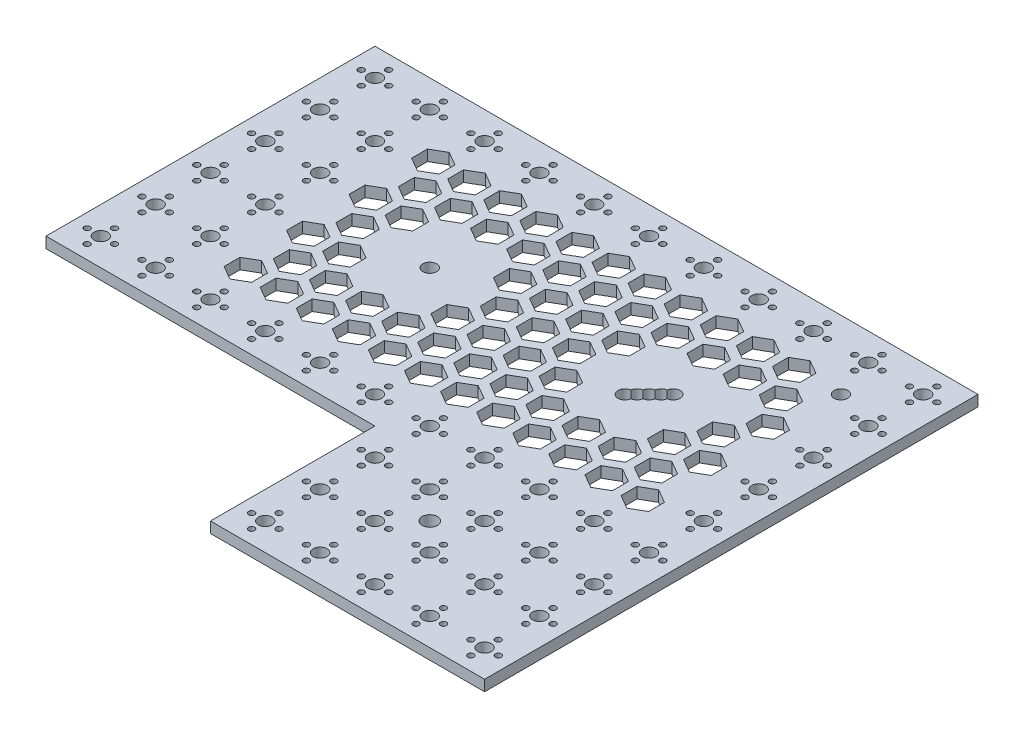
from build123d import *

# Parameters (mm, degrees)
BOSS_EXTRUDE1_DEPTH  = 6.35
SKETCH4_R            = 4
SKETCH4_R_2          = 4.5
CUT_EXTRUDE1_DEPTH   = 341.223929934
SKETCH4_3_R          = 4
CUT_EXTRUDE7_DEPTH   = 10
LPATTERN3_COUNT      = 3
LPATTERN3_PITCH      = 5
LPATTERN3_COL_COUNT  = 3
LPATTERN3_COL_PITCH  = 5
SKETCH7_R            = 4
CUT_EXTRUDE4_DEPTH   = 341.223929934
SKETCH10_R           = 1.75
CUT_EXTRUDE5_DEPTH   = 341.223929934
LPATTERN2_COUNT      = 11
LPATTERN2_PITCH      = 32
LPATTERN2_COUNT_DIR2 = 9
LPATTERN2_PITCH_DIR2 = 32
LPATTERN1_COUNT      = 11
LPATTERN1_PITCH      = 32
LPATTERN1_COUNT_DIR2 = 9
LPATTERN1_PITCH_DIR2 = 32
CUT_EXTRUDE6_DEPTH   = 341.223929934
FILL_PATTERN1_DEPTH  = 6.35
SKETCH15_R           = 4
CUT_EXTRUDE8_DEPTH   = 341.223929934


# Read off the part's stored shape, not the designer's step: Fill Pattern1
with BuildPart() as part:
    # Sketch3 → Boss-Extrude1 (new body)
    with BuildSketch(Plane(origin=(0, 0, 0), x_dir=(1, 0, 0), z_dir=(0, 1, 0))):
        Polygon((-256, 224), (-256, 32), (-64, 32), (-64, -64), (96, -64), (96, 224), align=None)
    extrude(amount=BOSS_EXTRUDE1_DEPTH)

    # Sketch4 → Cut-Extrude1 (cut, through all)
    with BuildSketch(Plane(origin=(0, 6.35, 0), x_dir=(1, 0, 0), z_dir=(0, 1, 0))):
        with Locations(Location((-128, 128, 0), (0, 0, 270))):
            Circle(SKETCH4_R)
        with Locations(Location((0, 0, 0), (0, 0, 270))):
            Circle(SKETCH4_R_2)
    extrude(amount=-CUT_EXTRUDE1_DEPTH, mode=Mode.SUBTRACT)

    # Sketch4<3> → Cut-Extrude7 (cut)
    with BuildSketch(Plane(origin=(0, 6.35, 0), x_dir=(1, 0, 0), z_dir=(0, 1, 0))):
        with Locations(Location((0, 128, 0), (0, 0, 270))):
            Circle(SKETCH4_3_R)
    cut_extrude7 = extrude(amount=-CUT_EXTRUDE7_DEPTH, mode=Mode.SUBTRACT)

    # LPattern3: Cut-Extrude7 ×3
    with Locations(*[Vector(0.7071067811865454, 0, -0.7071067811865497) * (i * LPATTERN3_PITCH) for i in range(1, LPATTERN3_COUNT)]):
        add(cut_extrude7, mode=Mode.SUBTRACT)

    # LPattern3 col: Cut-Extrude7 ×3
    with Locations(*[Vector(-0.7071067811865468, 0, 0.7071067811865483) * (i * LPATTERN3_COL_PITCH) for i in range(1, LPATTERN3_COL_COUNT)]):
        add(cut_extrude7, mode=Mode.SUBTRACT)

    # Sketch7 → Cut-Extrude4 (cut, through all)
    with BuildSketch(Plane(origin=(0, 6.35, 0), x_dir=(1, 0, 0), z_dir=(0, 1, 0))):
        with Locations(Location((80, 208, 0), (0, 0, 270))):
            Circle(SKETCH7_R)
    cut_extrude4 = extrude(amount=-CUT_EXTRUDE4_DEPTH, mode=Mode.SUBTRACT)

    # Sketch10 → Cut-Extrude5 (cut, through all)
    with BuildSketch(Plane(origin=(0, 6.35, 0), x_dir=(1, 0, 0), z_dir=(0, 1, 0))):
        with Locations(Location((88, 208, 0), (0, 0, 270))):
            Circle(SKETCH10_R)
        with Locations(Location((80, 200, 0), (0, 0, 270))):
            Circle(SKETCH10_R)
        with Locations(Location((72, 208, 0), (0, 0, 270))):
            Circle(SKETCH10_R)
        with Locations(Location((80, 216, 0), (0, 0, 270))):
            Circle(SKETCH10_R)
    cut_extrude5 = extrude(amount=-CUT_EXTRUDE5_DEPTH, mode=Mode.SUBTRACT)

    # LPattern2: Cut-Extrude5 11 × 9, 32 skipped
    with Locations(*[(-i * LPATTERN2_PITCH, 0, j * LPATTERN2_PITCH_DIR2) for i in range(LPATTERN2_COUNT) for j in range(LPATTERN2_COUNT_DIR2) if (i, j) not in ((0, 0), (1, 1), (1, 2), (1, 3), (1, 4), (2, 1), (2, 2), (2, 3), (2, 4), (3, 1), (3, 2), (3, 3), (3, 4), (4, 1), (4, 2), (4, 3), (4, 4), (5, 1), (5, 2), (5, 3), (5, 4), (6, 1), (6, 2), (6, 3), (6, 4), (7, 1), (7, 2), (7, 3), (7, 4), (8, 1), (8, 2), (8, 3), (8, 4))]):
        add(cut_extrude5, mode=Mode.SUBTRACT)

    # LPattern1: Cut-Extrude4 11 × 9, 32 skipped
    with Locations(*[(-i * LPATTERN1_PITCH, 0, j * LPATTERN1_PITCH_DIR2) for i in range(LPATTERN1_COUNT) for j in range(LPATTERN1_COUNT_DIR2) if (i, j) not in ((0, 0), (1, 1), (1, 2), (1, 3), (1, 4), (2, 1), (2, 2), (2, 3), (2, 4), (3, 1), (3, 2), (3, 3), (3, 4), (4, 1), (4, 2), (4, 3), (4, 4), (5, 1), (5, 2), (5, 3), (5, 4), (6, 1), (6, 2), (6, 3), (6, 4), (7, 1), (7, 2), (7, 3), (7, 4), (8, 1), (8, 2), (8, 3), (8, 4))]):
        add(cut_extrude4, mode=Mode.SUBTRACT)

    # Sketch14 → Cut-Extrude6 (cut, through all)
    with BuildSketch(Plane(origin=(0, 6.35, 0), x_dir=(1, 0, 0), z_dir=(0, 1, 0))):
        Polygon((-109.436136057, 178.088285743), (-109.436136057, 187.362761914), (-117.468068029, 192), (-125.5, 187.362761914), (-125.5, 178.088285743), (-117.468068029, 173.451047657), align=None)
    extrude(amount=-CUT_EXTRUDE6_DEPTH, mode=Mode.SUBTRACT)

    # Fill Pattern1 outline → Fill Pattern1 (cut)
    with BuildSketch(Plane(origin=(0, 0, 0), x_dir=(1, 0, 0), z_dir=(0, 1, 0))):
        Polygon((-188.69159182, 141.604603195), (-180.659659849, 136.967365109), (-172.627727877, 141.604603195), (-172.627727877, 150.879079366), (-180.659659849, 155.516317452), (-188.69159182, 150.879079366), align=None)
        Polygon((-157.09579591, 159.846444469), (-149.063863939, 155.209206383), (-141.031931967, 159.846444469), (-141.031931967, 169.12092064), (-149.063863939, 173.758158726), (-157.09579591, 169.12092064), align=None)
        Polygon((-93.90420409, 169.12092064), (-93.90420409, 159.846444469), (-85.872272119, 155.209206383), (-77.840340147, 159.846444469), (-77.840340147, 169.12092064), (-85.872272119, 173.758158726), align=None)
        Polygon((-62.30840818, 150.879079366), (-62.30840818, 141.604603195), (-54.276476209, 136.967365109), (-46.244544237, 141.604603195), (-46.244544237, 150.879079366), (-54.276476209, 155.516317452), align=None)
        Polygon((32.47897955, 96.153555545), (32.47897955, 86.879079373), (40.510911521, 82.241841288), (48.542843493, 86.879079373), (48.542843493, 96.153555545), (40.510911521, 100.790793631), align=None)
        Polygon((-117.468068029, 82.548952357), (-125.5, 77.911714271), (-125.5, 68.637238099), (-117.468068029, 64.000000014), (-109.436136057, 68.637238099), (-109.436136057, 77.911714271), align=None)
        Polygon((-188.69159182, 178.088285743), (-180.659659849, 173.451047657), (-172.627727877, 178.088285743), (-172.627727877, 187.362761914), (-180.659659849, 192), (-188.69159182, 187.362761914), align=None)
        Polygon((-93.90420409, 132.637238093), (-93.90420409, 123.362761921), (-85.872272119, 118.725523835), (-77.840340147, 123.362761921), (-77.840340147, 132.637238093), (-85.872272119, 137.274476178), align=None)
        Polygon((-62.30840818, 114.395396819), (-62.30840818, 105.120920647), (-54.276476209, 100.483682561), (-46.244544237, 105.120920647), (-46.244544237, 114.395396819), (-54.276476209, 119.032634904), align=None)
        Polygon((-30.71261227, 96.153555545), (-30.71261227, 86.879079373), (-22.680680299, 82.241841288), (-14.648748327, 86.879079373), (-14.648748327, 96.153555545), (-22.680680299, 100.790793631), align=None)
        Polygon((0.88318364, 77.911714271), (0.88318364, 68.637238099), (8.915115611, 64.000000014), (16.947047583, 68.637238099), (16.947047583, 77.911714271), (8.915115611, 82.548952357), align=None)
        Polygon((-180.659659849, 119.032634904), (-188.69159182, 114.395396819), (-188.69159182, 105.120920647), (-180.659659849, 100.483682561), (-172.627727877, 105.120920647), (-172.627727877, 114.395396819), align=None)
        Polygon((-180.659659849, 82.548952357), (-188.69159182, 77.911714271), (-188.69159182, 68.637238099), (-180.659659849, 64.000000014), (-172.627727877, 68.637238099), (-172.627727877, 77.911714271), align=None)
        Polygon((-93.90420409, 96.153555545), (-93.90420409, 86.879079373), (-85.872272119, 82.241841288), (-77.840340147, 86.879079373), (-77.840340147, 96.153555545), (-85.872272119, 100.790793631), align=None)
        Polygon((-62.30840818, 77.911714271), (-62.30840818, 68.637238099), (-54.276476209, 64.000000014), (-46.244544237, 68.637238099), (-46.244544237, 77.911714271), (-54.276476209, 82.548952357), align=None)
        Polygon((-178.15965985, 159.846444469), (-170.127727879, 155.209206383), (-162.095795907, 159.846444469), (-162.095795907, 169.12092064), (-170.127727879, 173.758158726), (-178.15965985, 169.12092064), align=None)
        Polygon((-146.56386394, 178.088285743), (-138.531931969, 173.451047657), (-130.499999997, 178.088285743), (-130.499999997, 187.362761914), (-138.531931969, 192), (-146.56386394, 187.362761914), align=None)
        Polygon((-83.37227212, 114.395396819), (-83.37227212, 105.120920647), (-75.340340149, 100.483682561), (-67.308408177, 105.120920647), (-67.308408177, 114.395396819), (-75.340340149, 119.032634904), align=None)
        Polygon((-51.77647621, 96.153555545), (-51.77647621, 86.879079373), (-43.744544239, 82.241841288), (-35.712612267, 86.879079373), (-35.712612267, 96.153555545), (-43.744544239, 100.790793631), align=None)
        Polygon((-20.1806803, 77.911714271), (-20.1806803, 68.637238099), (-12.148748329, 64.000000014), (-4.116816357, 68.637238099), (-4.116816357, 77.911714271), (-12.148748329, 82.548952357), align=None)
        Polygon((-170.127727879, 137.274476178), (-178.15965985, 132.637238093), (-178.15965985, 123.362761921), (-170.127727879, 118.725523835), (-162.095795907, 123.362761921), (-162.095795907, 132.637238093), align=None)
        Polygon((-170.127727879, 100.790793631), (-178.15965985, 96.153555545), (-178.15965985, 86.879079373), (-170.127727879, 82.241841288), (-162.095795907, 86.879079373), (-162.095795907, 96.153555545), align=None)
        Polygon((-167.62772788, 178.088285743), (-159.595795909, 173.451047657), (-151.563863937, 178.088285743), (-151.563863937, 187.362761914), (-159.595795909, 192), (-167.62772788, 187.362761914), align=None)
        Polygon((-136.03193197, 169.12092064), (-136.03193197, 159.846444469), (-127.999999999, 155.209206383), (-119.968068027, 159.846444469), (-119.968068027, 169.12092064), (-127.999999999, 173.758158726), align=None)
        Polygon((-104.43613606, 150.879079366), (-104.43613606, 141.604603195), (-96.404204089, 136.967365109), (-88.372272117, 141.604603195), (-88.372272117, 150.879079366), (-96.404204089, 155.516317452), align=None)
        Polygon((-72.84034015, 132.637238093), (-72.84034015, 123.362761921), (-64.808408179, 118.725523835), (-56.776476207, 123.362761921), (-56.776476207, 132.637238093), (-64.808408179, 137.274476178), align=None)
        Polygon((-41.24454424, 114.395396819), (-41.24454424, 105.120920647), (-33.212612269, 100.483682561), (-25.180680297, 105.120920647), (-25.180680297, 114.395396819), (-33.212612269, 119.032634904), align=None)
        Polygon((-9.64874833, 96.153555545), (-9.64874833, 86.879079373), (-1.616816359, 82.241841288), (6.415115613, 86.879079373), (6.415115613, 96.153555545), (-1.616816359, 100.790793631), align=None)
        Polygon((21.94704758, 77.911714271), (21.94704758, 68.637238099), (29.978979551, 64.000000014), (38.010911523, 68.637238099), (38.010911523, 77.911714271), (29.978979551, 82.548952357), align=None)
        Polygon((-159.595795909, 155.516317452), (-167.62772788, 150.879079366), (-167.62772788, 141.604603195), (-159.595795909, 136.967365109), (-151.563863937, 141.604603195), (-151.563863937, 150.879079366), align=None)
        Polygon((-159.595795909, 119.032634904), (-167.62772788, 114.395396819), (-167.62772788, 105.120920647), (-159.595795909, 100.483682561), (-151.563863937, 105.120920647), (-151.563863937, 114.395396819), align=None)
        Polygon((-159.595795909, 82.548952357), (-167.62772788, 77.911714271), (-167.62772788, 68.637238099), (-159.595795909, 64.000000014), (-151.563863937, 68.637238099), (-151.563863937, 77.911714271), align=None)
        Polygon((-62.30840818, 178.088285743), (-54.276476209, 173.451047657), (-46.244544237, 178.088285743), (-46.244544237, 187.362761914), (-54.276476209, 192), (-62.30840818, 187.362761914), align=None)
        Polygon((-157.09579591, 96.153555545), (-157.09579591, 86.879079373), (-149.063863939, 82.241841288), (-141.031931967, 86.879079373), (-141.031931967, 96.153555545), (-149.063863939, 100.790793631), align=None)
        Polygon((-114.96806803, 159.846444469), (-106.936136059, 155.209206383), (-98.904204087, 159.846444469), (-98.904204087, 169.12092064), (-106.936136059, 173.758158726), (-114.96806803, 169.12092064), align=None)
        Polygon((-83.37227212, 178.088285743), (-75.340340149, 173.451047657), (-67.308408177, 178.088285743), (-67.308408177, 187.362761914), (-75.340340149, 192), (-83.37227212, 187.362761914), align=None)
        Polygon((-114.96806803, 96.153555545), (-114.96806803, 86.879079373), (-106.936136059, 82.241841288), (-98.904204087, 86.879079373), (-98.904204087, 96.153555545), (-106.936136059, 100.790793631), align=None)
        Polygon((-83.37227212, 77.911714271), (-83.37227212, 68.637238099), (-75.340340149, 64.000000014), (-67.308408177, 68.637238099), (-67.308408177, 77.911714271), (-75.340340149, 82.548952357), align=None)
        Polygon((-104.43613606, 178.088285743), (-96.404204089, 173.451047657), (-88.372272117, 178.088285743), (-88.372272117, 187.362761914), (-96.404204089, 192), (-104.43613606, 187.362761914), align=None)
        Polygon((-104.43613606, 114.395396819), (-104.43613606, 105.120920647), (-96.404204089, 100.483682561), (-88.372272117, 105.120920647), (-88.372272117, 114.395396819), (-96.404204089, 119.032634904), align=None)
        Polygon((-72.84034015, 96.153555545), (-72.84034015, 86.879079373), (-64.808408179, 82.241841288), (-56.776476207, 86.879079373), (-56.776476207, 96.153555545), (-64.808408179, 100.790793631), align=None)
        Polygon((-41.24454424, 77.911714271), (-41.24454424, 68.637238099), (-33.212612269, 64.000000014), (-25.180680297, 68.637238099), (-25.180680297, 77.911714271), (-33.212612269, 82.548952357), align=None)
        Polygon((-83.37227212, 150.879079366), (-83.37227212, 141.604603195), (-75.340340149, 136.967365109), (-67.308408177, 141.604603195), (-67.308408177, 150.879079366), (-75.340340149, 155.516317452), align=None)
        Polygon((-51.77647621, 132.637238093), (-51.77647621, 123.362761921), (-43.744544239, 118.725523835), (-35.712612267, 123.362761921), (-35.712612267, 132.637238093), (-43.744544239, 137.274476178), align=None)
        Polygon((11.41511561, 96.153555545), (11.41511561, 86.879079373), (19.447047581, 82.241841288), (27.478979553, 86.879079373), (27.478979553, 96.153555545), (19.447047581, 100.790793631), align=None)
        Polygon((43.01091152, 77.911714271), (43.01091152, 68.637238099), (51.042843491, 64.000000014), (59.074775463, 68.637238099), (59.074775463, 77.911714271), (51.042843491, 82.548952357), align=None)
        Polygon((-138.531931969, 82.548952357), (-146.56386394, 77.911714271), (-146.56386394, 68.637238099), (-138.531931969, 64.000000014), (-130.499999997, 68.637238099), (-130.499999997, 77.911714271), align=None)
        Polygon((-30.71261227, 159.846444469), (-22.680680299, 155.209206383), (-14.648748327, 159.846444469), (-14.648748327, 169.12092064), (-22.680680299, 173.758158726), (-30.71261227, 169.12092064), align=None)
        Polygon((0.88318364, 178.088285743), (8.915115611, 173.451047657), (16.947047583, 178.088285743), (16.947047583, 187.362761914), (8.915115611, 192), (0.88318364, 187.362761914), align=None)
        Polygon((-51.77647621, 159.846444469), (-43.744544239, 155.209206383), (-35.712612267, 159.846444469), (-35.712612267, 169.12092064), (-43.744544239, 173.758158726), (-51.77647621, 169.12092064), align=None)
        Polygon((-20.1806803, 178.088285743), (-12.148748329, 173.451047657), (-4.116816357, 178.088285743), (-4.116816357, 187.362761914), (-12.148748329, 192), (-20.1806803, 187.362761914), align=None)
        Polygon((-72.84034015, 159.846444469), (-64.808408179, 155.209206383), (-56.776476207, 159.846444469), (-56.776476207, 169.12092064), (-64.808408179, 173.758158726), (-72.84034015, 169.12092064), align=None)
        Polygon((-41.24454424, 178.088285743), (-33.212612269, 173.451047657), (-25.180680297, 178.088285743), (-25.180680297, 187.362761914), (-33.212612269, 192), (-41.24454424, 187.362761914), align=None)
        Polygon((-136.03193197, 96.153555545), (-136.03193197, 86.879079373), (-127.999999999, 82.241841288), (-119.968068027, 86.879079373), (-119.968068027, 96.153555545), (-127.999999999, 100.790793631), align=None)
        Polygon((-104.43613606, 77.911714271), (-104.43613606, 68.637238099), (-96.404204089, 64.000000014), (-88.372272117, 68.637238099), (-88.372272117, 77.911714271), (-96.404204089, 82.548952357), align=None)
        Polygon((-41.24454424, 141.604603195), (-33.212612269, 136.967365109), (-25.180680297, 141.604603195), (-25.180680297, 150.879079366), (-33.212612269, 155.516317452), (-41.24454424, 150.879079366), align=None)
        Polygon((-9.64874833, 159.846444469), (-1.616816359, 155.209206383), (6.415115613, 159.846444469), (6.415115613, 169.12092064), (-1.616816359, 173.758158726), (-9.64874833, 169.12092064), align=None)
        Polygon((21.94704758, 178.088285743), (29.978979551, 173.451047657), (38.010911523, 178.088285743), (38.010911523, 187.362761914), (29.978979551, 192), (21.94704758, 187.362761914), align=None)
        Polygon((21.94704758, 114.395396819), (21.94704758, 105.120920647), (29.978979551, 100.483682561), (38.010911523, 105.120920647), (38.010911523, 114.395396819), (29.978979551, 119.032634904), align=None)
        Polygon((11.41511561, 159.846444469), (19.447047581, 155.209206383), (27.478979553, 159.846444469), (27.478979553, 169.12092064), (19.447047581, 173.758158726), (11.41511561, 169.12092064), align=None)
        Polygon((43.01091152, 114.395396819), (43.01091152, 105.120920647), (51.042843491, 100.483682561), (59.074775463, 105.120920647), (59.074775463, 114.395396819), (51.042843491, 119.032634904), align=None)
        Polygon((32.47897955, 159.846444469), (40.510911521, 155.209206383), (48.542843493, 159.846444469), (48.542843493, 169.12092064), (40.510911521, 173.758158726), (32.47897955, 169.12092064), align=None)
        Polygon((32.47897955, 132.637238093), (32.47897955, 123.362761921), (40.510911521, 118.725523835), (48.542843493, 123.362761921), (48.542843493, 132.637238093), (40.510911521, 137.274476178), align=None)
        Polygon((43.01091152, 141.604603195), (51.042843491, 136.967365109), (59.074775463, 141.604603195), (59.074775463, 150.879079366), (51.042843491, 155.516317452), (43.01091152, 150.879079366), align=None)
    extrude(amount=FILL_PATTERN1_DEPTH, mode=Mode.SUBTRACT)

    # Sketch15 → Cut-Extrude8 (cut, through all)
    with BuildSketch(Plane(origin=(0, 6.35, 0), x_dir=(1, 0, 0), z_dir=(0, 1, 0))):
        with Locations(Location((56, 183.999999999, 0), (0, 0, 270))):
            Circle(SKETCH15_R)
    extrude(amount=-CUT_EXTRUDE8_DEPTH, mode=Mode.SUBTRACT)


solid = part.part
